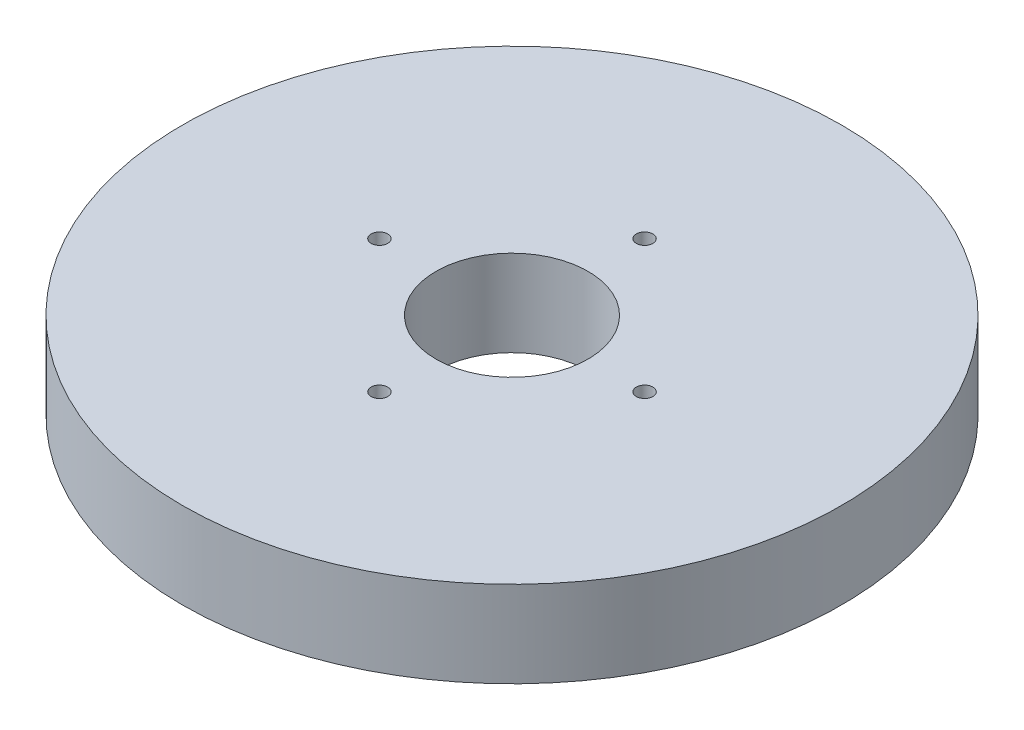
from build123d import *

# Parameters (mm, degrees)
SKETCH1_R           = 65
BOSS_EXTRUDE1_DEPTH = 17
SKETCH2_R           = 15
CUT_EXTRUDE1_DEPTH  = 94.482618705
SKETCH3_R           = 1.630870724
CUT_EXTRUDE2_DEPTH  = 11.018207346
CIRPATTERN1_COUNT   = 4


with BuildPart() as part:
    # Sketch1 → Boss-Extrude1 (new body)
    with BuildSketch(Plane(origin=(0, 0, 0), x_dir=(1, 0, 0), z_dir=(0, 1, 0))):
        Circle(SKETCH1_R)
    extrude(amount=BOSS_EXTRUDE1_DEPTH)

    # Sketch2 → Cut-Extrude1 (cut, through all)
    with BuildSketch(Plane(origin=(0, 0, 0), x_dir=(1, 0, 0), z_dir=(0, 1, 0))):
        Circle(SKETCH2_R)
    extrude(amount=CUT_EXTRUDE1_DEPTH, mode=Mode.SUBTRACT)

    # Sketch3 → Cut-Extrude2 (cut)
    with BuildSketch(Plane(origin=(0, 17, 0), x_dir=(1, 0, 0), z_dir=(0, 1, 0))):
        with Locations((-26.15316058, 0)):
            Circle(SKETCH3_R)
    cut_extrude2 = extrude(amount=-CUT_EXTRUDE2_DEPTH, mode=Mode.SUBTRACT)

    # CirPattern1: Cut-Extrude2 ×4 about axis
    cirpattern1_axis = Axis((0, 0, 0), (0, 1, 0))
    for i in range(1, CIRPATTERN1_COUNT):
        add(cut_extrude2.rotate(cirpattern1_axis, i * 360 / CIRPATTERN1_COUNT), mode=Mode.SUBTRACT)


solid = part.part
